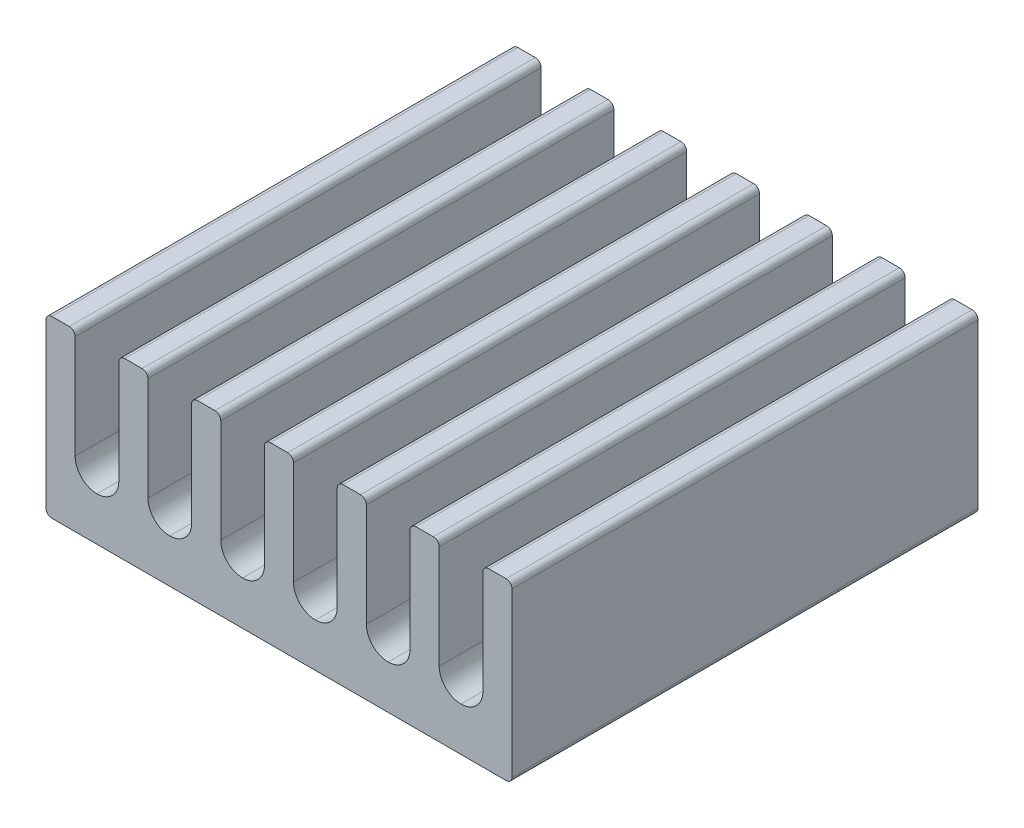
from build123d import *

# Parameters (mm, degrees)
SKETCH2_W           = 16
SKETCH2_H           = 16
BOSS_EXTRUDE1_DEPTH = 1.5
SKETCH3_W           = 1
SKETCH3_H           = 4.5
BOSS_EXTRUDE2_DEPTH = 16
FILLET1_R           = 0.75
FILLET2_R           = 0.2


with BuildPart() as part:
    # Sketch2 → Boss-Extrude1 (new body)
    with BuildSketch(Plane(origin=(0, 0, 0), x_dir=(1, 0, 0), z_dir=(0, 1, 0))):
        Rectangle(SKETCH2_W, SKETCH2_H)
    extrude(amount=BOSS_EXTRUDE1_DEPTH)

    # Sketch3 → Boss-Extrude2 (add)
    with BuildSketch(Plane.XY.offset(8)):
        with Locations((-7.5, 3.75)):
            Rectangle(SKETCH3_W, SKETCH3_H)
        with Locations((-5, 3.75)):
            Rectangle(SKETCH3_W, SKETCH3_H)
        with Locations((-2.5, 3.75)):
            Rectangle(SKETCH3_W, SKETCH3_H)
        with Locations((0, 3.75)):
            Rectangle(SKETCH3_W, SKETCH3_H)
        with Locations((2.5, 3.75)):
            Rectangle(SKETCH3_W, SKETCH3_H)
        with Locations((5, 3.75)):
            Rectangle(SKETCH3_W, SKETCH3_H)
        with Locations((7.5, 3.75)):
            Rectangle(SKETCH3_W, SKETCH3_H)
    extrude(amount=-BOSS_EXTRUDE2_DEPTH)

    # Fillet1
    fillet1_edges = [part.edges().sort_by_distance(p)[0] for p in [
        (7, 1.5, 0),
        (5.5, 1.5, 0),
        (4.5, 1.5, 0),
        (3, 1.5, 0),
        (2, 1.5, 0),
        (0.5, 1.5, 0),
        (-0.5, 1.5, 0),
        (-2, 1.5, 0),
        (-3, 1.5, 0),
        (-4.5, 1.5, 0),
        (-5.5, 1.5, 0),
        (-7, 1.5, 0),
    ]]
    fillet(fillet1_edges, radius=FILLET1_R - 0.0001)  # a hair under: the kernel refuses the full size

    # Fillet2
    fillet2_edges = [part.edges().sort_by_distance(p)[0] for p in [
        (-7, 6, 0),
        (-8, 6, 0),
        (-4.5, 6, 0),
        (-5.5, 6, 0),
        (-2, 6, 0),
        (-3, 6, 0),
        (0.5, 6, 0),
        (-0.5, 6, 0),
        (-8, 0, 0),
        (3, 6, 0),
        (2, 6, 0),
        (5.5, 6, 0),
        (4.5, 6, 0),
        (8, 0, 0),
        (8, 6, 0),
        (7, 6, 0),
    ]]
    fillet(fillet2_edges, radius=FILLET2_R)


solid = part.part
